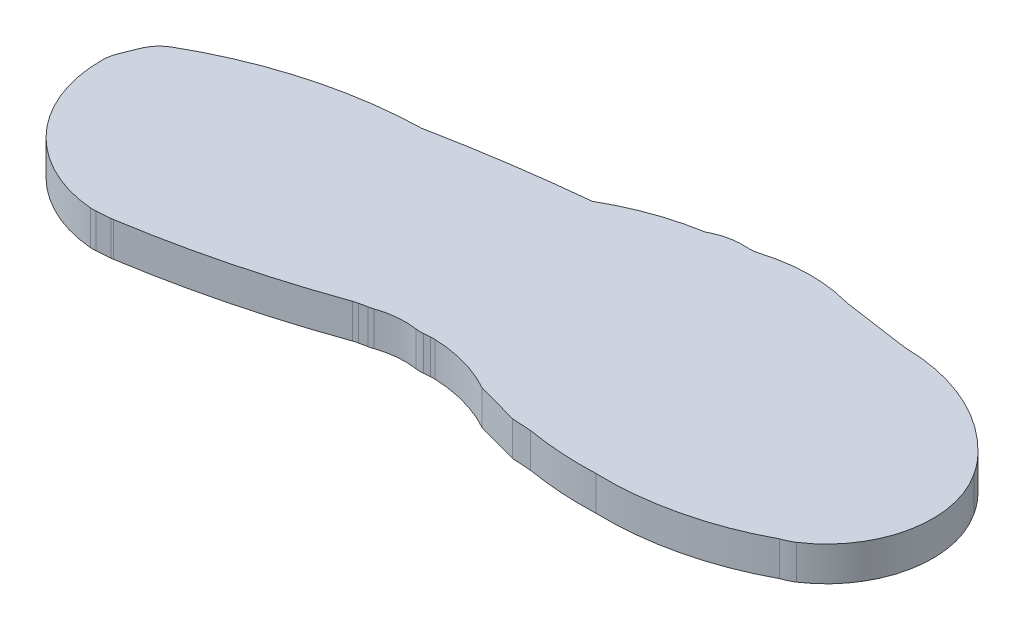
from build123d import *

# Parameters (mm, degrees)
BOSS_EXTRUDE1_DEPTH  = 10
BOSS_EXTRUDE2_DEPTH  = 10
FILLET1_R            = 10
BOSS_EXTRUDE3_DEPTH  = 10
FILLET2_R            = 10
FILLET3_R            = 10
BOSS_EXTRUDE4_DEPTH  = 10
BOSS_EXTRUDE5_DEPTH  = 10
BOSS_EXTRUDE6_DEPTH  = 10
BOSS_EXTRUDE7_DEPTH  = 10
BOSS_EXTRUDE8_DEPTH  = 10
BOSS_EXTRUDE9_DEPTH  = 10
BOSS_EXTRUDE10_DEPTH = 10
BOSS_EXTRUDE11_DEPTH = 10
BOSS_EXTRUDE12_DEPTH = 10
BOSS_EXTRUDE13_DEPTH = 10
FILLET4_R            = 10
FILLET5_R            = 10
FILLET6_R            = 10
BOSS_EXTRUDE14_DEPTH = 3
BOSS_EXTRUDE16_START = -3
BOSS_EXTRUDE16_DEPTH = 3
BOSS_EXTRUDE17_START = -3
BOSS_EXTRUDE17_DEPTH = 3
BOSS_EXTRUDE18_DEPTH = 3
BOSS_EXTRUDE19_START = -3
BOSS_EXTRUDE19_DEPTH = 3
BOSS_EXTRUDE20_START = -3
BOSS_EXTRUDE20_DEPTH = 3
BOSS_EXTRUDE21_START = -3
BOSS_EXTRUDE21_DEPTH = 3
BOSS_EXTRUDE22_START = -3
BOSS_EXTRUDE22_DEPTH = 3
BOSS_EXTRUDE23_DEPTH = 3
BOSS_EXTRUDE24_DEPTH = 3
BOSS_EXTRUDE25_START = -3
BOSS_EXTRUDE25_DEPTH = 3
BOSS_EXTRUDE26_START = -3
BOSS_EXTRUDE26_DEPTH = 3
BOSS_EXTRUDE27_START = -3
BOSS_EXTRUDE27_DEPTH = 3


with BuildPart() as part:
    # Sketch1 → Boss-Extrude1 (new body)
    with BuildSketch(Plane(origin=(0, 0, 0), x_dir=(1, 0, 0), z_dir=(0, 1, 0))):
        with BuildLine():
            Line((51.805250568, 46.254728184), (56.867580546, 46.690093705))
            Line((56.867580546, 46.690093705), (66.599539174, 71.853555984))
            Line((66.599539174, 71.853555984), (87.069484898, 91.437016001))
            Line((87.069484898, 91.437016001), (113.057432433, 61.102946487))
            Line((113.057432433, 61.102946487), (116.82467317, 61.854548169))
            Line((116.82467317, 61.854548169), (90.836725634, 92.188617682))
            Line((90.836725634, 92.188617682), (105.035116548, 105.898750841))
            Line((105.035116548, 105.898750841), (129.568132848, 62.950498647))
            Line((129.568132848, 62.950498647), (133.31455682, 63.272694914))
            Line((133.31455682, 63.272694914), (123.357580852, 80.374925591))
            Line((123.357580852, 80.374925591), (148.785651419, 102.172519068))
            Line((148.785651419, 102.172519068), (153.040868267, 57.891104139))
            Line((153.040868267, 57.891104139), (165.185425052, 54.57791328))
            Line((165.185425052, 54.57791328), (160.590576177, 102.174000873))
            Line((160.590576177, 102.174000873), (179.658076638, 104.906387862))
            Line((179.658076638, 104.906387862), (170.767457679, 54.218871994))
            ThreePointArc((170.767457679, 54.218871994), (180.837217506, 53.04614218), (190.97424035, 52.919153825))
            Line((190.97424035, 52.919153825), (197.981646973, 92.870031941))
            Line((197.981646973, 92.870031941), (234.078179475, 63.123049205))
            ThreePointArc((234.078179475, 63.123049205), (235.810126624, 63.828566908), (237.445115175, 64.736426258))
            Line((237.445115175, 64.736426258), (225.536614511, 74.55016567))
            Line((225.536614511, 74.55016567), (246.091874592, 107.449582187))
            ThreePointArc((246.091874592, 107.449582187), (243.840681793, 110.618047464), (241.25389096, 113.519004964))
            Line((241.25389096, 113.519004964), (240.395012362, 112.144339568))
            Line((240.395012362, 112.144339568), (219.839752281, 79.244923051))
            Line((219.839752281, 79.244923051), (198.654111375, 96.703910123))
            Line((198.654111375, 96.703910123), (204.382089549, 129.360464852))
            Line((204.382089549, 129.360464852), (184.447051736, 132.209464557))
            Line((184.447051736, 132.209464557), (180.419423262, 109.247004562))
            Line((180.419423262, 109.247004562), (160.097156473, 107.285125983))
            Line((160.097156473, 107.285125983), (158.308732306, 125.810652197))
            Line((158.308732306, 125.810652197), (157.766479573, 131.427617904))
            ThreePointArc((157.766479573, 131.427617904), (151.800844978, 131.395283067), (146.165668691, 129.437061966))
            Line((146.165668691, 129.437061966), (147.843325617, 111.978721981))
            Line((147.843325617, 111.978721981), (144.813827038, 109.125716877))
            Line((144.813827038, 109.125716877), (119.385756471, 87.3281234))
            Line((119.385756471, 87.3281234), (108.602540339, 106.205552911))
            Line((108.602540339, 106.205552911), (107.52160572, 107.900291772))
            Line((107.52160572, 107.900291772), (115.140722033, 114.033426524))
            Line((115.140722033, 114.033426524), (122.553726759, 120.438529801))
            ThreePointArc((122.553726759, 120.438529801), (122.391169983, 120.703903688), (122.08857731, 120.776606365))
            Line((122.08857731, 120.776606365), (117.367703847, 118.588729188))
            Line((117.367703847, 118.588729188), (69.895175345, 80.374925591))
            Line((69.895175345, 80.374925591), (83.054291448, 114.72858327))
            Line((83.054291448, 114.72858327), (79.00377159, 114.380234447))
            Line((79.00377159, 114.380234447), (59.63165965, 65.85792942))
            Line((59.63165965, 65.85792942), (19.328949542, 96.752897561))
            Line((19.328949542, 96.752897561), (15.566189716, 87.3281234))
            Line((15.566189716, 87.3281234), (55.868899823, 56.433155258))
            Line((55.868899823, 56.433155258), (51.805250568, 46.254728184))
        make_face()
    extrude(amount=BOSS_EXTRUDE1_DEPTH)

    # Sketch3 → Boss-Extrude2 (add)
    with BuildSketch(Plane(origin=(0, 0, 0), x_dir=(-1, 0, 0), z_dir=(0, -1, 0))):
        with BuildLine():
            Line((-184.447051736, 132.209464557), (-184.096250604, 130.209464557))
            ThreePointArc((-184.096250604, 130.209464557), (-170.969249532, 131.779309143), (-157.95955632, 129.427617904))
            Line((-157.95955632, 129.427617904), (-157.766479573, 131.427617904))
            ThreePointArc((-157.766479573, 131.427617904), (-171.046827654, 133.863929723), (-184.447051736, 132.209464557))
        make_face()
    extrude(amount=-BOSS_EXTRUDE2_DEPTH)

    # Fillet1
    fillet1_edges = [part.edges().sort_by_distance(p)[0] for p in [
        (157.766479573, 5, -131.427617904),
    ]]
    fillet(fillet1_edges, radius=FILLET1_R)

    # Sketch4 → Boss-Extrude3 (add)
    with BuildSketch(Plane.XZ):
        with BuildLine():
            Line((241.25389096, -113.519004964), (240.194147983, -111.822849068))
            ThreePointArc((240.194147983, -111.822849068), (223.645469846, -123.160543749), (204.036563274, -127.390538053))
            Line((204.036563274, -127.390538053), (204.382089549, -129.360464852))
            ThreePointArc((204.382089549, -129.360464852), (224.4077507, -125.139982982), (241.25389096, -113.519004964))
        make_face()
    extrude(amount=-BOSS_EXTRUDE3_DEPTH)

    # Fillet2
    fillet2_edges = [part.edges().sort_by_distance(p)[0] for p in [
        (204.382089549, 5, -129.360464852),
    ]]
    fillet(fillet2_edges, radius=FILLET2_R)

    # Fillet3
    fillet3_edges = [part.edges().sort_by_distance(p)[0] for p in [
        (184.447051736, 5, -132.209464557),
    ]]
    fillet(fillet3_edges, radius=FILLET3_R)

    # Sketch5 → Boss-Extrude4 (add)
    with BuildSketch(Plane(origin=(0, 0, 0), x_dir=(-1, 0, 0), z_dir=(0, -1, 0))):
        with BuildLine():
            Line((-146.165668691, 129.437061966), (-146.35697717, 127.446232725))
            ThreePointArc((-146.35697717, 127.446232725), (-134.153534544, 124.9675725), (-122.553726759, 120.438529801))
            ThreePointArc((-122.553726759, 120.438529801), (-122.391169983, 120.703903688), (-122.08857731, 120.776606365))
            ThreePointArc((-122.08857731, 120.776606365), (-133.74228961, 126.176716529), (-146.165668691, 129.437061966))
        make_face()
    extrude(amount=-BOSS_EXTRUDE4_DEPTH)

    # Sketch6 → Boss-Extrude5 (add)
    with BuildSketch(Plane.XZ):
        with BuildLine():
            Line((117.367703847, -118.588729188), (83.054291448, -114.72858327))
            Line((83.054291448, -114.72858327), (79.00377159, -114.380234447))
            ThreePointArc((79.00377159, -114.380234447), (100.4688886, -118.099003928), (122.08857731, -120.776606365))
            Line((122.08857731, -120.776606365), (117.367703847, -118.588729188))
        make_face()
    extrude(amount=-BOSS_EXTRUDE5_DEPTH)

    # Sketch7 → Boss-Extrude6 (add)
    with BuildSketch(Plane(origin=(0, 10, 0), x_dir=(1, 0, 0), z_dir=(0, 1, 0))):
        with BuildLine():
            Line((79.00377159, 114.380234447), (78.262205131, 112.522795568))
            ThreePointArc((78.262205131, 112.522795568), (48.512953701, 107.66287103), (20.916234075, 95.536128144))
            Line((20.916234075, 95.536128144), (19.328949542, 96.752897561))
            ThreePointArc((19.328949542, 96.752897561), (48.002866802, 109.505407349), (79.00377159, 114.380234447))
        make_face()
    extrude(amount=-BOSS_EXTRUDE6_DEPTH)

    # Sketch8 → Boss-Extrude7 (add)
    with BuildSketch(Plane.XZ):
        with BuildLine():
            Line((51.805250568, -46.254728184), (52.546817026, -48.112167063))
            ThreePointArc((52.546817026, -48.112167063), (27.538270706, -60.301307017), (17.153474248, -86.111353983))
            Line((17.153474248, -86.111353983), (15.566189716, -87.3281234))
            ThreePointArc((15.566189716, -87.3281234), (25.179141466, -59.286070545), (51.805250568, -46.254728184))
        make_face()
    extrude(amount=-BOSS_EXTRUDE7_DEPTH)

    # Sketch9 → Boss-Extrude8 (add)
    with BuildSketch(Plane.XZ):
        with BuildLine():
            Line((56.867580546, -46.690093705), (57.589005486, -48.555447841))
            ThreePointArc((57.589005486, -48.555447841), (84.37250162, -56.744283383), (111.756215819, -62.621773443))
            Line((111.756215819, -62.621773443), (113.057432433, -61.102946487))
            ThreePointArc((113.057432433, -61.102946487), (85.305396239, -52.559732402), (56.867580546, -46.690093705))
        make_face()
    extrude(amount=-BOSS_EXTRUDE8_DEPTH)

    # Sketch10 → Boss-Extrude9 (add)
    with BuildSketch(Plane(origin=(0, 0, 0), x_dir=(-1, 0, 0), z_dir=(0, -1, 0))):
        with BuildLine():
            Line((-116.82467317, 61.854548169), (-115.523456556, 63.373375125))
            ThreePointArc((-115.523456556, 63.373375125), (-121.956257585, 64.95953709), (-128.576124511, 64.687138926))
            Line((-128.576124511, 64.687138926), (-129.568132848, 62.950498647))
            ThreePointArc((-129.568132848, 62.950498647), (-123.120409738, 63.286155655), (-116.82467317, 61.854548169))
        make_face()
    extrude(amount=-BOSS_EXTRUDE9_DEPTH)

    # Sketch11 → Boss-Extrude10 (add)
    with BuildSketch(Plane.XZ):
        with BuildLine():
            Line((153.040868267, -57.891104139), (152.849559788, -59.88193338))
            ThreePointArc((152.849559788, -59.88193338), (142.907546747, -63.760188349), (132.308272343, -65.001102144))
            Line((132.308272343, -65.001102144), (133.31455682, -63.272694914))
            ThreePointArc((133.31455682, -63.272694914), (143.510926178, -61.803299707), (153.040868267, -57.891104139))
        make_face()
    extrude(amount=-BOSS_EXTRUDE10_DEPTH)

    # Sketch12 → Boss-Extrude11 (add)
    with BuildSketch(Plane.XZ):
        Polygon((170.767457679, -54.218871994), (165.185425052, -54.57791328), (164.99324177, -56.568658263), (171.112983954, -56.188798793), align=None)
    extrude(amount=-BOSS_EXTRUDE11_DEPTH)

    # Sketch13 → Boss-Extrude12 (add)
    with BuildSketch(Plane.XZ):
        with BuildLine():
            Line((237.445115175, -64.736426258), (235.901683391, -66.008361134))
            ThreePointArc((235.901683391, -66.008361134), (248.258475049, -84.090973284), (245.032131615, -105.753426291))
            Line((245.032131615, -105.753426291), (246.091874592, -107.449582187))
            ThreePointArc((246.091874592, -107.449582187), (250.614679122, -84.302201712), (237.445115175, -64.736426258))
        make_face()
    extrude(amount=-BOSS_EXTRUDE12_DEPTH)

    # Sketch14 → Boss-Extrude13 (add)
    with BuildSketch(Plane.XZ):
        with BuildLine():
            Line((190.97424035, -52.919153825), (191.319766625, -54.889080624))
            ThreePointArc((191.319766625, -54.889080624), (212.52084719, -57.06838935), (232.534747692, -64.394984081))
            Line((232.534747692, -64.394984081), (234.078179475, -63.123049205))
            ThreePointArc((234.078179475, -63.123049205), (213.194515683, -55.198002086), (190.97424035, -52.919153825))
        make_face()
    extrude(amount=-BOSS_EXTRUDE13_DEPTH)

    # Fillet4
    fillet4_edges = [part.edges().sort_by_distance(p)[0] for p in [
        (133.31455682, 5, -63.272694914),
        (129.568132848, 5, -62.950498647),
        (116.82467317, 5, -61.854548169),
        (113.057432433, 5, -61.102946487),
    ]]
    fillet(fillet4_edges, radius=FILLET4_R)

    # Fillet5
    # the kernel refuses this fillet: 10 mm, written as the material it takes off along each edge
    with BuildSketch(Plane(origin=(56.867580546, -0.900144387, -46.690093705), x_dir=(0.9877650784630306, 0, -0.15594918970268098), z_dir=(0, 1, 0))) as fillet5_piece_1:
        with BuildLine():
            CenterArc((0.354164433, 9.999998263), FILLET5_R, 265.943550384, 4.090215864)
            Line((-0.353228281, 0.025049865), (0, 0))
            ThreePointArc((0, 0), (0.180028877, -5.3048e-05), (0.360057755, 0))
        make_face()
    extrude(amount=11.800288773, mode=Mode.SUBTRACT)
    with BuildSketch(Plane(origin=(51.805250568, -2.317018867, -46.254728184), x_dir=(0.9963223007849147, 0, -0.08568473002031346), z_dir=(0, 1, 0))) as fillet5_piece_2:
        with BuildLine():
            CenterArc((0.79824645, 10), FILLET5_R, 260.135505168, 9.864494831)
            ThreePointArc((-0.914939677, 0.147843216), (-0.45791207, 0.071184823), (0, 0))
            Line((0, 0), (0.79824645, 0))
        make_face()
    extrude(amount=14.634037735, mode=Mode.SUBTRACT)

    # Fillet6
    fillet6_edges = [part.edges().sort_by_distance(p)[0] for p in [
        (15.566189716, 5, -87.3281234),
        (19.328949542, 5, -96.752897561),
    ]]
    fillet(fillet6_edges, radius=FILLET6_R)

    # Sketch15 → Boss-Extrude14 (add)
    with BuildSketch(Plane(origin=(0, 10, 0), x_dir=(1, 0, 0), z_dir=(0, 1, 0))):
        with BuildLine():
            Line((78.262205131, 112.522795568), (59.63165965, 65.85792942))
            Line((59.63165965, 65.85792942), (20.916234075, 95.536128144))
            ThreePointArc((20.916234075, 95.536128144), (48.512953701, 107.66287103), (78.262205131, 112.522795568))
        make_face()
    extrude(amount=-BOSS_EXTRUDE14_DEPTH)

    # Sketch16 → Boss-Extrude16 (add)
    with BuildSketch(Plane(origin=(0, 10, 0), x_dir=(1, 0, 0), z_dir=(0, 1, 0)).offset(BOSS_EXTRUDE16_START)):
        with BuildLine():
            Line((52.546817026, 48.112167063), (55.868899823, 56.433155258))
            Line((55.868899823, 56.433155258), (17.153474248, 86.111353983))
            ThreePointArc((17.153474248, 86.111353983), (27.538270706, 60.301307017), (52.546817026, 48.112167063))
        make_face()
    extrude(amount=BOSS_EXTRUDE16_DEPTH)

    # Sketch20 → Boss-Extrude17 (add)
    with BuildSketch(Plane(origin=(0, 10, 0), x_dir=(1, 0, 0), z_dir=(0, 1, 0)).offset(BOSS_EXTRUDE17_START)):
        with BuildLine():
            Line((57.589005486, 48.555447841), (66.599539174, 71.853555984))
            Line((66.599539174, 71.853555984), (87.069484898, 91.437016001))
            Line((87.069484898, 91.437016001), (111.756215819, 62.621773443))
            ThreePointArc((111.756215819, 62.621773443), (84.37250162, 56.744283383), (57.589005486, 48.555447841))
        make_face()
    extrude(amount=BOSS_EXTRUDE17_DEPTH)

    # Sketch21 → Boss-Extrude18 (add)
    with BuildSketch(Plane(origin=(0, 10, 0), x_dir=(1, 0, 0), z_dir=(0, 1, 0))):
        Polygon((69.895175345, 80.374925591), (83.054291448, 114.72858327), (117.367703847, 118.588729188), align=None)
    extrude(amount=-BOSS_EXTRUDE18_DEPTH)

    # Sketch22 → Boss-Extrude19 (add)
    with BuildSketch(Plane(origin=(0, 10, 0), x_dir=(1, 0, 0), z_dir=(0, 1, 0)).offset(BOSS_EXTRUDE19_START)):
        with BuildLine():
            Line((115.523456556, 63.373375125), (90.836725634, 92.188617682))
            Line((90.836725634, 92.188617682), (105.035116548, 105.898750841))
            Line((105.035116548, 105.898750841), (128.576124511, 64.687138926))
            ThreePointArc((128.576124511, 64.687138926), (121.956257585, 64.95953709), (115.523456556, 63.373375125))
        make_face()
    extrude(amount=BOSS_EXTRUDE19_DEPTH)

    # Sketch23 → Boss-Extrude20 (add)
    with BuildSketch(Plane(origin=(0, 10, 0), x_dir=(1, 0, 0), z_dir=(0, 1, 0)).offset(BOSS_EXTRUDE20_START)):
        with BuildLine():
            Line((152.849559788, 59.88193338), (148.785651419, 102.172519068))
            Line((148.785651419, 102.172519068), (123.357580852, 80.374925591))
            Line((123.357580852, 80.374925591), (132.308272343, 65.001102144))
            ThreePointArc((132.308272343, 65.001102144), (142.907546747, 63.760188349), (152.849559788, 59.88193338))
        make_face()
    extrude(amount=BOSS_EXTRUDE20_DEPTH)

    # Sketch24 → Boss-Extrude21 (add)
    with BuildSketch(Plane(origin=(0, 10, 0), x_dir=(1, 0, 0), z_dir=(0, 1, 0)).offset(BOSS_EXTRUDE21_START)):
        with BuildLine():
            Line((107.52160572, 107.900291772), (108.602540339, 106.205552911))
            Line((108.602540339, 106.205552911), (119.385756471, 87.3281234))
            Line((119.385756471, 87.3281234), (147.843325617, 111.978721981))
            Line((147.843325617, 111.978721981), (146.35697717, 127.446232725))
            ThreePointArc((146.35697717, 127.446232725), (134.153534544, 124.9675725), (122.553726759, 120.438529801))
            Line((122.553726759, 120.438529801), (115.140722033, 114.033426524))
            Line((115.140722033, 114.033426524), (107.52160572, 107.900291772))
        make_face()
    extrude(amount=BOSS_EXTRUDE21_DEPTH)

    # Sketch25 → Boss-Extrude22 (add)
    with BuildSketch(Plane(origin=(0, 10, 0), x_dir=(1, 0, 0), z_dir=(0, 1, 0)).offset(BOSS_EXTRUDE22_START)):
        with BuildLine():
            Line((157.95955632, 129.427617904), (160.097156473, 107.285125983))
            Line((160.097156473, 107.285125983), (180.419423262, 109.247004562))
            Line((180.419423262, 109.247004562), (184.096250604, 130.209464557))
            ThreePointArc((184.096250604, 130.209464557), (170.969249532, 131.779309143), (157.95955632, 129.427617904))
        make_face()
    extrude(amount=BOSS_EXTRUDE22_DEPTH)

    # Sketch26 → Boss-Extrude23 (add)
    with BuildSketch(Plane(origin=(0, 10, 0), x_dir=(1, 0, 0), z_dir=(0, 1, 0))):
        Polygon((160.590576177, 102.174000873), (164.99324177, 56.568658263), (171.112983954, 56.188798793), (179.658076638, 104.906387862), align=None)
    extrude(amount=-BOSS_EXTRUDE23_DEPTH)

    # Sketch27 → Boss-Extrude24 (add)
    with BuildSketch(Plane(origin=(0, 10, 0), x_dir=(1, 0, 0), z_dir=(0, 1, 0))):
        Polygon((119.385756471, 87.3281234), (144.813827038, 109.125716877), (147.843325617, 111.978721981), align=None)
    extrude(amount=-BOSS_EXTRUDE24_DEPTH)

    # Sketch28 → Boss-Extrude25 (add)
    with BuildSketch(Plane(origin=(0, 10, 0), x_dir=(1, 0, 0), z_dir=(0, 1, 0)).offset(BOSS_EXTRUDE25_START)):
        with BuildLine():
            Line((235.901683391, 66.008361134), (225.536614511, 74.55016567))
            Line((225.536614511, 74.55016567), (245.032131615, 105.753426291))
            ThreePointArc((245.032131615, 105.753426291), (248.258475049, 84.090973284), (235.901683391, 66.008361134))
        make_face()
    extrude(amount=BOSS_EXTRUDE25_DEPTH)

    # Sketch29 → Boss-Extrude26 (add)
    with BuildSketch(Plane(origin=(0, 10, 0), x_dir=(1, 0, 0), z_dir=(0, 1, 0)).offset(BOSS_EXTRUDE26_START)):
        with BuildLine():
            Line((191.319766625, 54.889080624), (197.981646973, 92.870031941))
            Line((197.981646973, 92.870031941), (232.534747692, 64.394984081))
            ThreePointArc((232.534747692, 64.394984081), (212.52084719, 57.06838935), (191.319766625, 54.889080624))
        make_face()
    extrude(amount=BOSS_EXTRUDE26_DEPTH)

    # Sketch30 → Boss-Extrude27 (add)
    with BuildSketch(Plane(origin=(0, 10, 0), x_dir=(1, 0, 0), z_dir=(0, 1, 0)).offset(BOSS_EXTRUDE27_START)):
        with BuildLine():
            Line((204.036563274, 127.390538053), (198.654111375, 96.703910123))
            Line((198.654111375, 96.703910123), (219.839752281, 79.244923051))
            Line((219.839752281, 79.244923051), (240.194147983, 111.822849068))
            ThreePointArc((240.194147983, 111.822849068), (223.645469846, 123.160543749), (204.036563274, 127.390538053))
        make_face()
    extrude(amount=BOSS_EXTRUDE27_DEPTH)


solid = part.part
